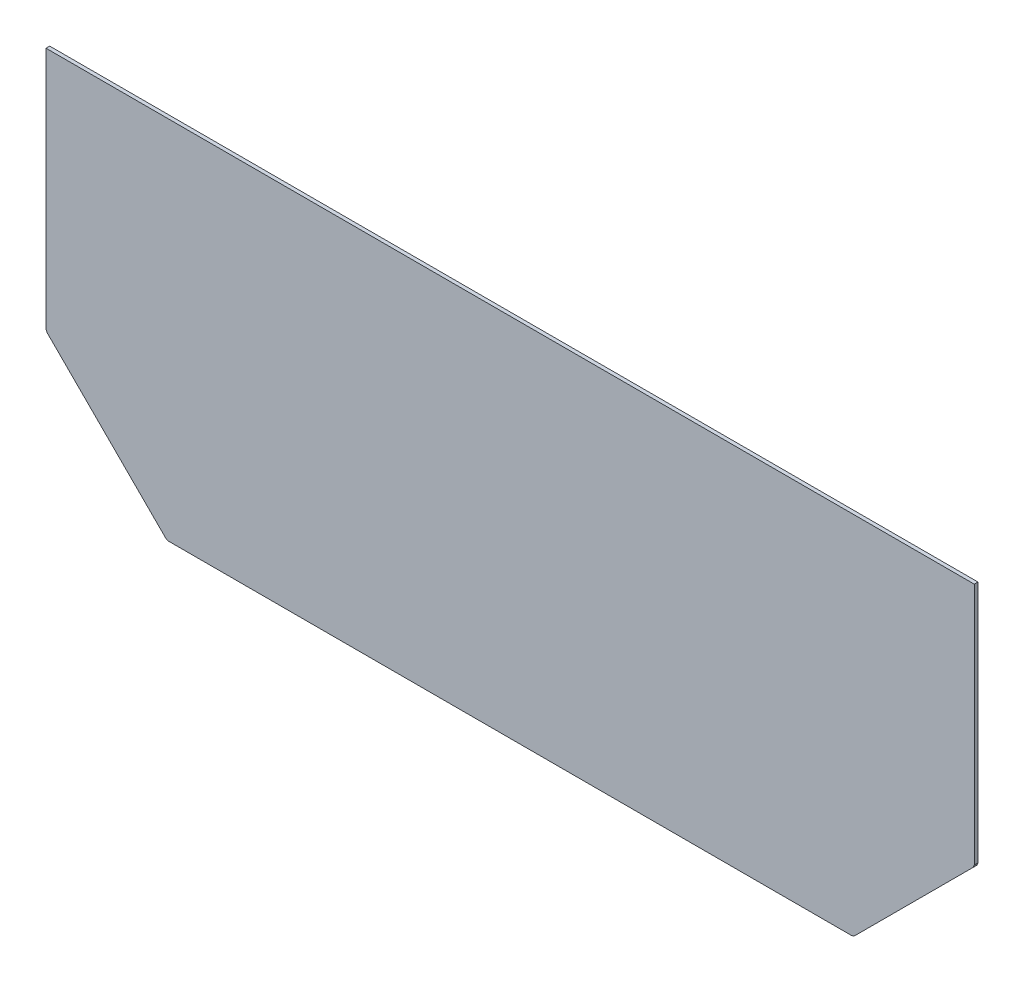
from build123d import *

# Parameters (mm, degrees)
TABAN_FLAN_1_DEPTH = 6


# Sheet-metal steps are written as plain solids
with BuildPart() as part:
    # Çizim1 → Taban-Flanş1 (new body)
    with BuildSketch(Plane.XY):
        Polygon((-685.090920801, -304.110479042), (424.967953702, -304.110479042), (429.210594389, -302.353119729), (622.181157137, -109.382556981), (623.93851645, -105.139916293), (623.93851645, 289.889520958), (-884.06148355, 289.889520958), (-884.06148355, -105.139916293), (-882.304124237, -109.382556981), (-689.333561488, -302.353119729), align=None)
    extrude(amount=-TABAN_FLAN_1_DEPTH)


solid = part.part
